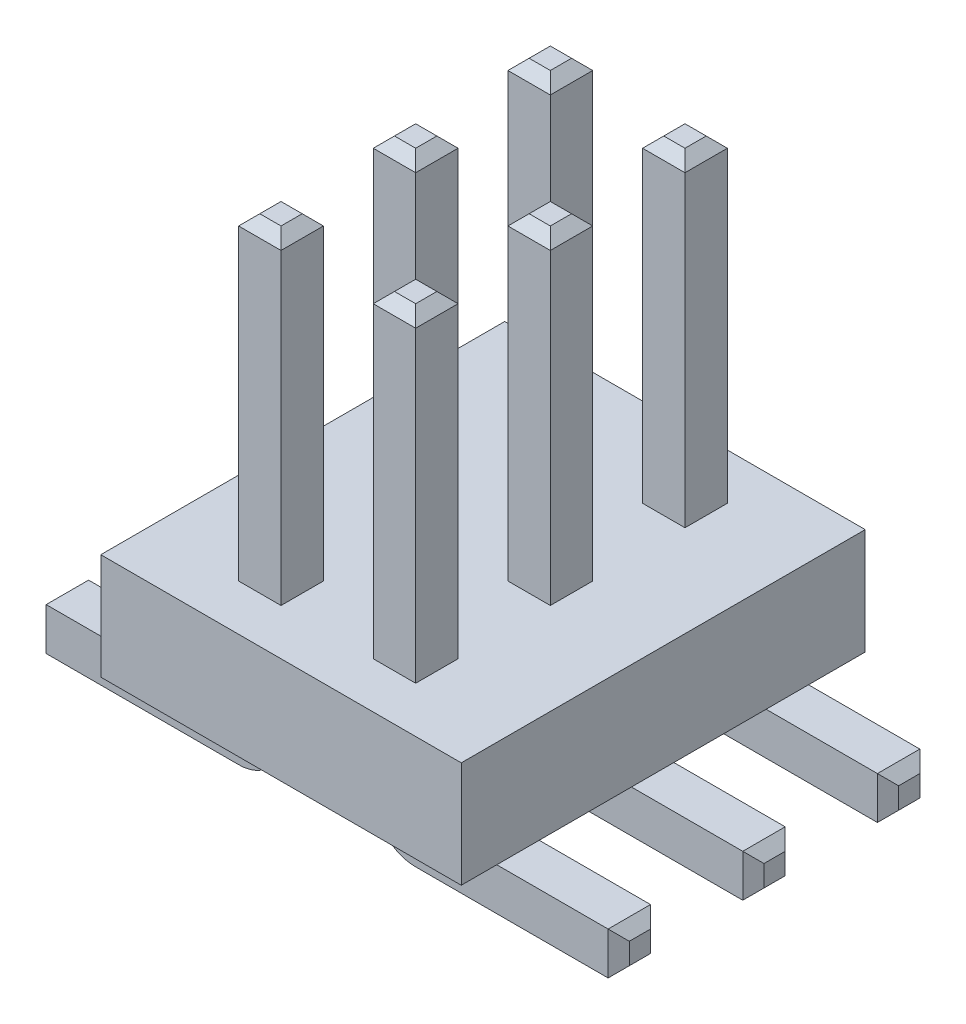
from build123d import *

# Parameters (mm, degrees)
SKIZZE1_W                       = 3.4
SKIZZE1_H                       = 1
AUFSATZ_LINEAR_AUSTRAGEN1_DEPTH = 3.81
SKIZZE3_W                       = 0.4
SKIZZE3_H                       = 0.4
AUFSATZ_LINEAR_AUSTRAGEN3_DEPTH = 0.5
SKIZZE4_W                       = 0.4
SKIZZE4_H                       = 0.4
AUFSATZ_LINEAR_AUSTRAGEN4_DEPTH = 1.915
SKIZZE5_W                       = 0.4
SKIZZE5_H                       = 0.4
AUFSATZ_LINEAR_AUSTRAGEN5_DEPTH = 1.915
SKIZZE6_W                       = 0.4
SKIZZE6_H                       = 0.4
AUFSATZ_LINEAR_AUSTRAGEN6_DEPTH = 3
FASE2_SIZE                      = 0.1
VERRUNDUNG1_R                   = 0.1
VERRUNDUNG2_R                   = 0.4


with BuildPart() as part:
    # Skizze1 → Aufsatz-Linear austragen1 (new body)
    with BuildSketch(Plane.XY):
        with Locations((1.7, 0.5)):
            Rectangle(SKIZZE1_W, SKIZZE1_H)
    extrude(amount=AUFSATZ_LINEAR_AUSTRAGEN1_DEPTH)

    # Skizze3 → Aufsatz-Linear austragen3 (add)
    with BuildSketch(Plane.XZ):
        with Locations((1.065, 3.175)):
            Rectangle(SKIZZE3_W, SKIZZE3_H)
        with Locations((2.335, 3.175)):
            Rectangle(SKIZZE3_W, SKIZZE3_H)
        with Locations((1.065, 1.905)):
            Rectangle(SKIZZE3_W, SKIZZE3_H)
        with Locations((2.335, 1.905)):
            Rectangle(SKIZZE3_W, SKIZZE3_H)
        with Locations((1.065, 0.635)):
            Rectangle(SKIZZE3_W, SKIZZE3_H)
        with Locations((2.335, 0.635)):
            Rectangle(SKIZZE3_W, SKIZZE3_H)
    extrude(amount=AUFSATZ_LINEAR_AUSTRAGEN3_DEPTH)

    # Skizze4 → Aufsatz-Linear austragen4 (add)
    with BuildSketch(Plane(origin=(2.535, 0, 0), x_dir=(0, 0, -1), z_dir=(1, 0, 0))):
        with Locations((-3.175, -0.3)):
            Rectangle(SKIZZE4_W, SKIZZE4_H)
        with Locations((-1.905, -0.3)):
            Rectangle(SKIZZE4_W, SKIZZE4_H)
        with Locations((-0.635, -0.3)):
            Rectangle(SKIZZE4_W, SKIZZE4_H)
    extrude(amount=AUFSATZ_LINEAR_AUSTRAGEN4_DEPTH)

    # Skizze5 → Aufsatz-Linear austragen5 (add)
    with BuildSketch(Plane.ZY.offset(-0.865)):
        with Locations((3.175, -0.3)):
            Rectangle(SKIZZE5_W, SKIZZE5_H)
        with Locations((1.905, -0.3)):
            Rectangle(SKIZZE5_W, SKIZZE5_H)
        with Locations((0.635, -0.3)):
            Rectangle(SKIZZE5_W, SKIZZE5_H)
    extrude(amount=AUFSATZ_LINEAR_AUSTRAGEN5_DEPTH)

    # Skizze6 → Aufsatz-Linear austragen6 (add)
    with BuildSketch(Plane(origin=(0, 1, 0), x_dir=(1, 0, 0), z_dir=(0, 1, 0))):
        with Locations((1.065, -0.635)):
            Rectangle(SKIZZE6_W, SKIZZE6_H)
        with Locations((2.335, -0.635)):
            Rectangle(SKIZZE6_W, SKIZZE6_H)
        with Locations((1.065, -1.905)):
            Rectangle(SKIZZE6_W, SKIZZE6_H)
        with Locations((2.335, -1.905)):
            Rectangle(SKIZZE6_W, SKIZZE6_H)
        with Locations((1.065, -3.175)):
            Rectangle(SKIZZE6_W, SKIZZE6_H)
        with Locations((2.335, -3.175)):
            Rectangle(SKIZZE6_W, SKIZZE6_H)
    extrude(amount=AUFSATZ_LINEAR_AUSTRAGEN6_DEPTH)

    # Fase2
    fase2_edges = [part.edges().sort_by_distance(p)[0] for p in [
        (4.45, -0.3, 0.835),
        (4.45, -0.5, 0.635),
        (4.45, -0.3, 0.435),
        (4.45, -0.1, 0.635),
        (-1.05, -0.3, 3.375),
        (-1.05, -0.1, 3.175),
        (-1.05, -0.3, 2.975),
        (-1.05, -0.5, 3.175),
        (-1.05, -0.3, 2.105),
        (-1.05, -0.1, 1.905),
        (-1.05, -0.3, 1.705),
        (-1.05, -0.5, 1.905),
        (-1.05, -0.3, 0.835),
        (-1.05, -0.1, 0.635),
        (-1.05, -0.3, 0.435),
        (-1.05, -0.5, 0.635),
        (1.265, 4, 0.635),
        (1.065, 4, 0.435),
        (0.865, 4, 0.635),
        (1.065, 4, 0.835),
        (2.535, 4, 0.635),
        (2.335, 4, 0.435),
        (2.135, 4, 0.635),
        (2.335, 4, 0.835),
        (1.265, 4, 1.905),
        (1.065, 4, 1.705),
        (0.865, 4, 1.905),
        (1.065, 4, 2.105),
        (2.535, 4, 1.905),
        (2.335, 4, 1.705),
        (2.135, 4, 1.905),
        (2.335, 4, 2.105),
        (1.265, 4, 3.175),
        (1.065, 4, 2.975),
        (0.865, 4, 3.175),
        (1.065, 4, 3.375),
        (2.535, 4, 3.175),
        (2.335, 4, 2.975),
        (2.135, 4, 3.175),
        (2.335, 4, 3.375),
        (4.45, -0.3, 3.375),
        (4.45, -0.5, 3.175),
        (4.45, -0.3, 2.975),
        (4.45, -0.1, 3.175),
        (4.45, -0.3, 2.105),
        (4.45, -0.5, 1.905),
        (4.45, -0.3, 1.705),
        (4.45, -0.1, 1.905),
    ]]
    chamfer(fase2_edges, length=FASE2_SIZE)

    # Verrundung1
    verrundung1_edges = [part.edges().sort_by_distance(p)[0] for p in [
        (0.865, -0.1, 3.175),
        (0.865, -0.1, 1.905),
        (0.865, -0.1, 0.635),
        (2.535, -0.1, 3.175),
        (2.535, -0.1, 1.905),
        (2.535, -0.1, 0.635),
    ]]
    fillet(verrundung1_edges, radius=VERRUNDUNG1_R - 0.0001)  # a hair under: the kernel refuses the full size

    # Verrundung2
    verrundung2_edges = [part.edges().sort_by_distance(p)[0] for p in [
        (1.265, -0.5, 3.175),
        (2.135, -0.5, 3.175),
        (1.265, -0.5, 1.905),
        (2.135, -0.5, 1.905),
        (1.265, -0.5, 0.635),
        (2.135, -0.5, 0.635),
    ]]
    fillet(verrundung2_edges, radius=VERRUNDUNG2_R)


solid = part.part
